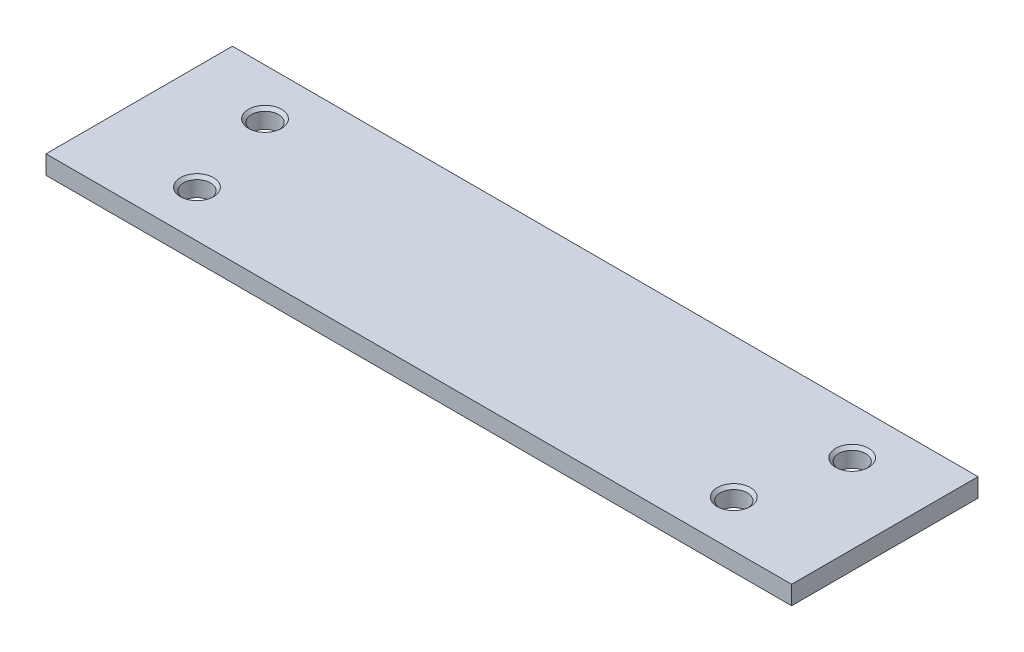
from build123d import *

# Parameters (mm, degrees)
SKETCH_1_W                     = 80
SKETCH_1_H                     = 20
EXTRUDE_1_DEPTH                = 2
HOLE_WIZARD_M3_5_1_D           = 2.9
HOLE_WIZARD_M3_5_1_CSINK_D     = 3.55
HOLE_WIZARD_M3_5_1_CSINK_ANGLE = 90


with BuildPart() as part:
    # 草图1 → 凸台-拉伸1 (new body)
    with BuildSketch(Plane(origin=(0, 0, 0), x_dir=(1, 0, 0), z_dir=(0, 1, 0))):
        with Locations((40, 10)):
            Rectangle(SKETCH_1_W, SKETCH_1_H)
    extrude(amount=EXTRUDE_1_DEPTH)

    # M3.5 螺纹孔1 (through all)
    with Locations(Plane(origin=(0, 2, 0), x_dir=(1, 0, 0), z_dir=(0, 1, 0))):
        with Locations((8.5, 15), (11.2, 5), (71.5, 15), (68.8, 5)):
            CounterSinkHole(HOLE_WIZARD_M3_5_1_D / 2, HOLE_WIZARD_M3_5_1_CSINK_D / 2, counter_sink_angle=HOLE_WIZARD_M3_5_1_CSINK_ANGLE)


solid = part.part
